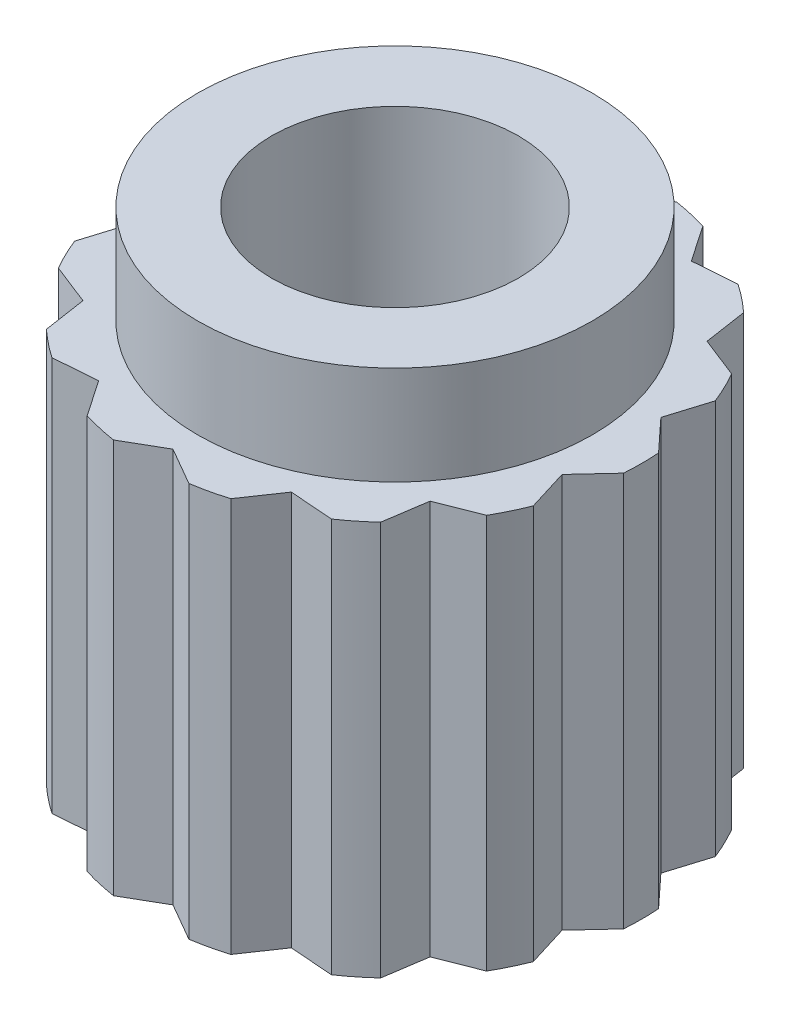
from build123d import *

# Parameters (mm, degrees)
MAINBODYS_R           = 2.5
MAIN_BODY_DEPTH       = 2
M3X0_5_TAPPED_HOLE1_D = 2.5
GROOVED_CUT_DEPTH     = 6.338539126
GC_START              = -2
GC_CP_DEPTH           = 4
PRESSFITBODYS_R       = 2
PRESSFITBODYS_R_2     = 1.25
PRESS_FIT_BODY_DEPTH  = 1


# Read off the part's stored shape, not the designer's step: GC CP
with BuildPart() as part:
    # MainBodyS → MAIN BODY (new, symmetric)
    with BuildSketch(Plane(origin=(0, 0, 0), x_dir=(1, 0, 0), z_dir=(0, 1, 0))):
        with Locations(Location((0, 0, 0), (0, 0, 270))):
            Circle(MAINBODYS_R)
    extrude(amount=MAIN_BODY_DEPTH, both=True)

    # M3x0.5 Tapped Hole1 (through all)
    with Locations(Plane(origin=(0, 2, 0), x_dir=(1, 0, 0), z_dir=(0, 1, 0))):
        with Locations((0, 0)):
            Hole(M3X0_5_TAPPED_HOLE1_D / 2)

    # GroovedCutS → GROOVED CUT (cut, through all)
    with BuildSketch(Plane(origin=(0, 2, 0), x_dir=(1, 0, 0), z_dir=(0, 1, 0))):
        with BuildLine():
            Line((0, 2.25), (0.382129822, 2.470622755))
            ThreePointArc((0.382129822, 2.470622755), (0, 2.5), (-0.382129822, 2.470622755))
            Line((-0.382129822, 2.470622755), (0, 2.25))
        make_face()
    extrude(amount=-GROOVED_CUT_DEPTH, mode=Mode.SUBTRACT)

    # GC CP outline → GC CP (cut)
    with BuildSketch(Plane(origin=(0, 0, 0), x_dir=(1, 0, 0), z_dir=(0, 1, 0)).offset(GC_START)):
        with BuildLine():
            ThreePointArc((-0.727675966, 2.391754103), (-1.084709348, 2.25242217), (-1.416250112, 2.060154271))
            Line((-1.416250112, 2.060154271), (-0.976238413, 2.027179953))
            Line((-0.976238413, 2.027179953), (-0.727675966, 2.391754103))
        make_face()
        with BuildLine():
            Line((0.976238413, 2.027179953), (1.416250112, 2.060154271))
            ThreePointArc((1.416250112, 2.060154271), (1.084709348, 2.25242217), (0.727675966, 2.391754103))
            Line((0.727675966, 2.391754103), (0.976238413, 2.027179953))
        make_face()
        with BuildLine():
            Line((1.759120836, 1.402852054), (2.169864698, 1.241646967))
            ThreePointArc((2.169864698, 1.241646967), (1.954578706, 1.558724504), (1.693356605, 1.839169217))
            Line((1.693356605, 1.839169217), (1.759120836, 1.402852054))
        make_face()
        with BuildLine():
            Line((2.193587802, 0.500672101), (2.493710969, 0.177216254))
            ThreePointArc((2.493710969, 0.177216254), (2.43731978, 0.556302335), (2.3236472, 0.922314312))
            Line((2.3236472, 0.922314312), (2.193587802, 0.500672101))
        make_face()
        with BuildLine():
            Line((2.193587802, -0.500672101), (2.3236472, -0.922314312))
            ThreePointArc((2.3236472, -0.922314312), (2.43731978, -0.556302335), (2.493710969, -0.177216254))
            Line((2.493710969, -0.177216254), (2.193587802, -0.500672101))
        make_face()
        with BuildLine():
            Line((1.759120836, -1.402852054), (1.693356605, -1.839169217))
            ThreePointArc((1.693356605, -1.839169217), (1.954578706, -1.558724504), (2.169864698, -1.241646967))
            Line((2.169864698, -1.241646967), (1.759120836, -1.402852054))
        make_face()
        with BuildLine():
            Line((0.976238413, -2.027179953), (0.727675966, -2.391754103))
            ThreePointArc((0.727675966, -2.391754103), (1.084709348, -2.25242217), (1.416250112, -2.060154271))
            Line((1.416250112, -2.060154271), (0.976238413, -2.027179953))
        make_face()
        with BuildLine():
            Line((0, -2.25), (-0.382129822, -2.470622755))
            ThreePointArc((-0.382129822, -2.470622755), (0, -2.5), (0.382129822, -2.470622755))
            Line((0.382129822, -2.470622755), (0, -2.25))
        make_face()
        with BuildLine():
            Line((-0.976238413, -2.027179953), (-1.416250112, -2.060154271))
            ThreePointArc((-1.416250112, -2.060154271), (-1.084709348, -2.25242217), (-0.727675966, -2.391754103))
            Line((-0.727675966, -2.391754103), (-0.976238413, -2.027179953))
        make_face()
        with BuildLine():
            Line((-1.759120836, -1.402852054), (-2.169864698, -1.241646967))
            ThreePointArc((-2.169864698, -1.241646967), (-1.954578706, -1.558724504), (-1.693356605, -1.839169217))
            Line((-1.693356605, -1.839169217), (-1.759120836, -1.402852054))
        make_face()
        with BuildLine():
            Line((-2.193587802, -0.500672101), (-2.493710969, -0.177216254))
            ThreePointArc((-2.493710969, -0.177216254), (-2.43731978, -0.556302335), (-2.3236472, -0.922314312))
            Line((-2.3236472, -0.922314312), (-2.193587802, -0.500672101))
        make_face()
        with BuildLine():
            Line((-2.193587802, 0.500672101), (-2.3236472, 0.922314312))
            ThreePointArc((-2.3236472, 0.922314312), (-2.43731978, 0.556302335), (-2.493710969, 0.177216254))
            Line((-2.493710969, 0.177216254), (-2.193587802, 0.500672101))
        make_face()
        with BuildLine():
            Line((-1.759120836, 1.402852054), (-1.693356605, 1.839169217))
            ThreePointArc((-1.693356605, 1.839169217), (-1.954578706, 1.558724504), (-2.169864698, 1.241646967))
            Line((-2.169864698, 1.241646967), (-1.759120836, 1.402852054))
        make_face()
    extrude(amount=GC_CP_DEPTH, mode=Mode.SUBTRACT)

    # PressFitBodyS → PRESS FIT BODY (add)
    with BuildSketch(Plane(origin=(0, 2, 0), x_dir=(1, 0, 0), z_dir=(0, 1, 0))):
        with Locations(Location((0, 0, 0), (0, 0, 270))):
            Circle(PRESSFITBODYS_R)
        with Locations(Location((0, 0, 0), (0, 0, 270))):
            Circle(PRESSFITBODYS_R_2, mode=Mode.SUBTRACT)
    extrude(amount=PRESS_FIT_BODY_DEPTH)


solid = part.part
